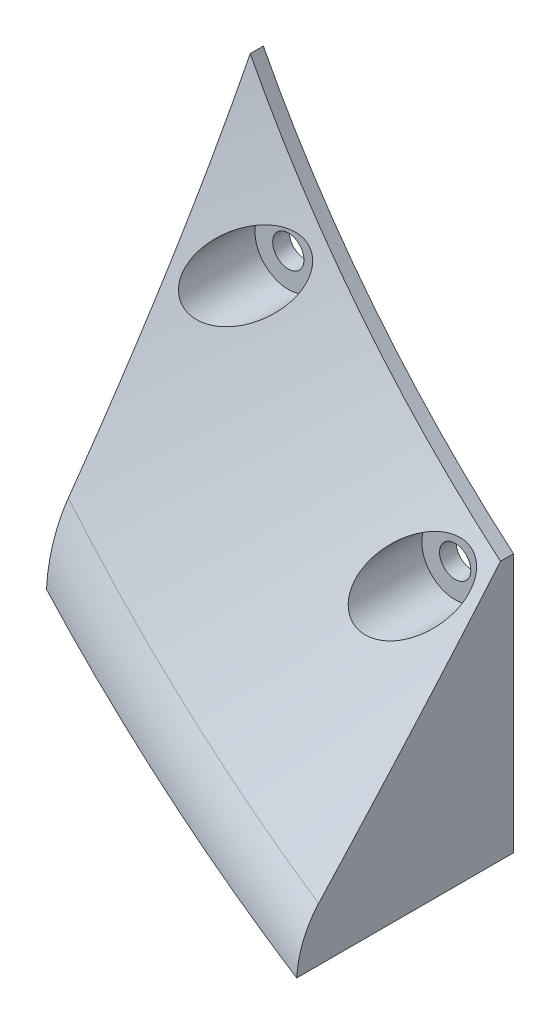
from build123d import *

# Parameters (mm, degrees)
SKETCH1_R               = 2.38125
BOSS_EXTRUDE1_DEPTH     = 3.175
BOSS_EXTRUDE2_DEPTH     = 50.8
CUT_EXTRUDE1_DEPTH      = 209.526843613
CUT_EXTRUDE1_DEPTH_BACK = 209.526843613
SKETCH3_R               = 203.829254644
SKETCH3_R_2             = 174.625
SKETCH5_R               = 2.38125
CUT_EXTRUDE3_DEPTH      = 200.484174202
SKETCH6_W               = 205.731089426
SKETCH6_H               = 25.4
BOSS_EXTRUDE3_DEPTH     = 3.175
SKETCH8_R               = 2.38125
CUT_EXTRUDE5_DEPTH      = 200.484174202
SKETCH9_W               = 205.731089426
SKETCH9_H               = 38.1
BOSS_EXTRUDE4_DEPTH     = 3.175
SKETCH10_R              = 6.35
SKETCH10_R_2            = 2.38125
CUT_EXTRUDE6_DEPTH      = 200.484174202
SKETCH11_W              = 53.331089426
SKETCH11_H              = 31.75
BOSS_EXTRUDE5_DEPTH     = 3.175
FILLET1_R               = 10.16
SKETCH12_R              = 6.35
SKETCH12_R_2            = 2.38125
CUT_EXTRUDE7_DEPTH      = 200.484174202
FILLET2_R               = 2.54
CUT_EXTRUDE8_DEPTH      = 200.484174202
SKETCH14_W              = 2.759281453
SKETCH14_H              = 7.963584416
SKETCH14_W_2            = 2.527010149
SKETCH14_H_2            = 5.938870156
BOSS_EXTRUDE6_DEPTH     = 3.175
FILLET3_R               = 2.54
SKETCH15_R              = 2.38125
BOSS_EXTRUDE7_DEPTH     = 33.02
SKETCH16_R              = 227.754671792
SKETCH16_W              = 368.539826918
SKETCH16_H              = 147.114866813
CUT_EXTRUDE9_DEPTH      = 217.033643064
SKETCH17_R              = 87.195519402
CUT_EXTRUDE10_DEPTH     = 217.033642998
CHAMFER1_SIZE           = 27.94
CHAMFER1_SIZE_2         = 31.030513664
CUT_EXTRUDE12_START     = -2.54
SKETCH18_R              = 5.08
CUT_EXTRUDE12_DEPTH     = 33.02
FILLET4_R               = 10.16


with BuildPart() as part:
    # Sketch1 → Boss-Extrude1 (new body)
    with BuildSketch(Plane.XY):
        with BuildLine():
            Line((-102.865544713, 31.75), (-102.865544713, 145.022480019))
            ThreePointArc((-102.865544713, 145.022480019), (-123.286100955, 128.114703728), (-140.965544713, 108.358457002))
            Line((-140.965544713, 108.358457002), (-140.965544713, -108.358457002))
            ThreePointArc((-140.965544713, -108.358457002), (-123.286100955, -128.114703728), (-102.865544713, -145.022480019))
            Line((-102.865544713, -145.022480019), (-102.865544713, -69.85))
            Line((-102.865544713, -69.85), (102.865544713, -69.85))
            Line((102.865544713, -69.85), (102.865544713, -145.022480019))
            ThreePointArc((102.865544713, -145.022480019), (123.286100955, -128.114703728), (140.965544713, -108.358457002))
            Line((140.965544713, -108.358457002), (140.965544713, 108.358457002))
            ThreePointArc((140.965544713, 108.358457002), (123.286100955, 128.114703728), (102.865544713, 145.022480019))
            Line((102.865544713, 145.022480019), (102.865544713, 31.75))
            Line((102.865544713, 31.75), (-102.865544713, 31.75))
        make_face()
        with Locations((25.4, -38.1)):
            Circle(SKETCH1_R, mode=Mode.SUBTRACT)
        with Locations((-25.4, -38.1)):
            Circle(SKETCH1_R, mode=Mode.SUBTRACT)
        with Locations((0, -38.1)):
            Circle(SKETCH1_R, mode=Mode.SUBTRACT)
    extrude(amount=BOSS_EXTRUDE1_DEPTH)

    # Sketch2 → Boss-Extrude2 (add)
    with BuildSketch(Plane.XY.offset(3.175)):
        with BuildLine():
            ThreePointArc((-102.865544713, -141.111907137), (-123.390730203, -123.566250752), (-140.965544713, -103.06602655))
            Line((-140.965544713, -103.06602655), (-140.965544713, -108.358457002))
            ThreePointArc((-140.965544713, -108.358457002), (-123.286100955, -128.114703728), (-102.865544713, -145.022480019))
            Line((-102.865544713, -145.022480019), (-102.865544713, -141.111907137))
        make_face()
        with BuildLine():
            ThreePointArc((140.965544713, -103.06602655), (123.390730203, -123.566250752), (102.865544713, -141.111907137))
            Line((102.865544713, -141.111907137), (102.865544713, -145.022480019))
            ThreePointArc((102.865544713, -145.022480019), (123.286100955, -128.114703728), (140.965544713, -108.358457002))
            Line((140.965544713, -108.358457002), (140.965544713, -103.06602655))
        make_face()
    extrude(amount=BOSS_EXTRUDE2_DEPTH)

    # Sketch3 → Cut-Extrude1 (cut, two sides: drawn at the far end of the back side and taken through both)
    with BuildSketch(Plane.XY.offset(3.175).offset(-CUT_EXTRUDE1_DEPTH_BACK)):
        Circle(SKETCH3_R)
        Circle(SKETCH3_R_2, mode=Mode.SUBTRACT)
    extrude(amount=CUT_EXTRUDE1_DEPTH + CUT_EXTRUDE1_DEPTH_BACK, mode=Mode.SUBTRACT)

    # Sketch5 → Cut-Extrude3 (cut, through all)
    with BuildSketch(Plane.XY.offset(3.175)):
        with Locations((134.615544713, -95.585904409)):
            Circle(SKETCH5_R)
        with Locations((109.215544713, -123.814275401)):
            Circle(SKETCH5_R)
        with Locations(Location((-134.615544713, -95.585904409, 0), (0, 0, 180))):
            Circle(SKETCH5_R)
        with Locations(Location((-109.215544713, -123.814275401, 0), (0, 0, 180))):
            Circle(SKETCH5_R)
    extrude(amount=-CUT_EXTRUDE3_DEPTH, mode=Mode.SUBTRACT)

    # Sketch6 → Boss-Extrude3 (add)
    with BuildSketch(Plane.XY.offset(3.175)):
        with Locations((0, 77.611907137)):
            Rectangle(SKETCH6_W, SKETCH6_H)
    extrude(amount=-BOSS_EXTRUDE3_DEPTH)

    # Sketch8 → Cut-Extrude5 (cut, through all)
    with BuildSketch(Plane.XY.offset(3.175)):
        with Locations((-38.1, -38.1)):
            Circle(SKETCH8_R)
        with Locations((-50.8, -38.1)):
            Circle(SKETCH8_R)
        with Locations((12.7, -38.1)):
            Circle(SKETCH8_R)
        with Locations((-12.7, -38.1)):
            Circle(SKETCH8_R)
    extrude(amount=-CUT_EXTRUDE5_DEPTH, mode=Mode.SUBTRACT)

    # Sketch9 → Boss-Extrude4 (add)
    with BuildSketch(Plane.XY.offset(3.175)):
        with Locations((0, -88.9)):
            Rectangle(SKETCH9_W, SKETCH9_H)
    extrude(amount=-BOSS_EXTRUDE4_DEPTH)

    # Sketch10 → Cut-Extrude6 (cut, through all)
    with BuildSketch(Plane.XY.offset(3.175)):
        with Locations((0, -76.2)):
            Circle(SKETCH10_R)
        with Locations((-25.4, -76.2)):
            Circle(SKETCH10_R_2)
        with Locations((-38.1, -76.2)):
            Circle(SKETCH10_R_2)
        with Locations((25.4, -76.2)):
            Circle(SKETCH10_R_2)
    extrude(amount=-CUT_EXTRUDE6_DEPTH, mode=Mode.SUBTRACT)

    # Sketch11 → Boss-Extrude5 (add)
    with BuildSketch(Plane.XY.offset(3.175)):
        with Locations((0, -123.825)):
            Rectangle(SKETCH11_W, SKETCH11_H)
    extrude(amount=-BOSS_EXTRUDE5_DEPTH)

    # Fillet1
    fillet1_edges = [part.edges().sort_by_distance(p)[0] for p in [
        (-26.665544713, -139.7, 1.5875),
        (-26.665544713, -107.95, 1.5875),
        (26.665544713, -107.95, 1.5875),
        (26.665544713, -139.7, 1.5875),
    ]]
    fillet(fillet1_edges, radius=FILLET1_R)

    # Sketch12 → Cut-Extrude7 (cut, through all)
    with BuildSketch(Plane.XY.offset(3.175)):
        with Locations((-25.4, -76.2)):
            Circle(SKETCH12_R)
        with Locations((25.4, -76.2)):
            Circle(SKETCH12_R)
        with Locations((-8.66775, -67.53225)):
            Circle(SKETCH12_R_2)
        with Locations((8.66775, -67.53225)):
            Circle(SKETCH12_R_2)
        with Locations((8.66775, -84.86775)):
            Circle(SKETCH12_R_2)
        with Locations((-8.66775, -84.86775)):
            Circle(SKETCH12_R_2)
    extrude(amount=-CUT_EXTRUDE7_DEPTH, mode=Mode.SUBTRACT)

    # Fillet2
    fillet2_edges = [part.edges().sort_by_distance(p)[0] for p in [
        (-102.865544713, 141.111907137, 1.5875),
        (102.865544713, 141.111907137, 1.5875),
    ]]
    fillet(fillet2_edges, radius=FILLET2_R)

    # Sketch13 → Cut-Extrude8 (cut, through all)
    # profile 1 of 4: a face of its own
    with BuildSketch(Plane.XY.offset(3.175)):
        with BuildLine():
            Line((-29.807958333, -15.810565048), (-38.216416667, -15.810565048))
            Line((-38.216416667, -15.810565048), (-33.538583333, 6.245101619))
            Line((-33.538583333, 6.245101619), (-38.803791667, 6.245101619))
            Line((-38.803791667, 6.245101619), (-39.682208333, 2.075268285))
            Line((-39.682208333, 2.075268285), (-48.095958333, 2.075268285))
            Line((-48.095958333, 2.075268285), (-47.397458333, 5.477809952))
            add(Edge.make_bspline(
                [(-47.397458333, 5.477809952), (-47.320569058, 5.758194134), (-47.170922216, 6.303895823), (-46.789013651, 7.053374007), (-46.29771223, 7.715065901), (-45.690436731, 8.272796577), (-45.006500067, 8.730292102), (-44.253147871, 9.054960677), (-43.448405111, 9.260244914), (-42.891974442, 9.282012228), (-42.6085, 9.293101619)],
                knots=[0, 0, 0, 0, 1.050168006, 2.043904372, 3.024673376, 4.01863537, 5.013909092, 5.989008141, 6.975497172, 8, 8, 8, 8], degree=3))
            Line((-42.6085, 9.293101619), (-24.463375, 9.293101619))
            Line((-24.463375, 9.293101619), (-29.807958333, -15.810565048))
        make_face()
    # profile 2 of 4: a face of its own
    with BuildSketch(Plane.XY.offset(3.175)):
        with BuildLine():
            add(Edge.make_bspline(
                [(-3.566583333, -12.132856715), (-3.643765668, -12.421811436), (-3.79437451, -12.985659844), (-4.17293599, -13.764550451), (-4.665381385, -14.453577746), (-5.270434906, -15.036263062), (-5.950809803, -15.518035961), (-6.703009887, -15.859816489), (-7.511777843, -16.068702787), (-8.070292693, -16.093985699), (-8.355541667, -16.106898381)],
                knots=[0, 0, 0, 0, 1.062369753, 2.073042759, 3.062499936, 4.061251344, 5.048575831, 6.014824268, 6.986115874, 8, 8, 8, 8], degree=3))
            Line((-8.355541667, -16.106898381), (-22.547791667, -16.106898381))
            add(Edge.make_bspline(
                [(-22.547791667, -16.106898381), (-22.69262218, -16.104596964), (-22.972752339, -16.100145578), (-23.378206431, -16.044702396), (-23.755568174, -15.960682303), (-24.107157142, -15.846746121), (-24.426210233, -15.691540895), (-24.716954418, -15.504453058), (-24.976786635, -15.281711317), (-25.203806964, -15.025677099), (-25.40308213, -14.746169713), (-25.554358436, -14.435544628), (-25.674211179, -14.106195373), (-25.74344938, -13.752832717), (-25.791514529, -13.37950469), (-25.77975916, -12.981941289), (-25.73922686, -12.562383844), (-25.682974686, -12.278883611), (-25.654, -12.132856715)],
                knots=[0, 0, 0, 0, 1.158779845, 2.241303809, 3.269110906, 4.251580925, 5.192683609, 6.101443689, 7.012833415, 7.922909267, 8.835720222, 9.751475912, 10.680528402, 11.633319635, 12.628295421, 13.687540584, 14.808885378, 16, 16, 16, 16], degree=3))
            Line((-25.654, -12.132856715), (-21.997458333, 5.319059952))
            add(Edge.make_bspline(
                [(-21.997458333, 5.319059952), (-21.920272116, 5.608009048), (-21.769655695, 6.171846477), (-21.391148554, 6.950815808), (-20.898502375, 7.639552216), (-20.293153244, 8.224337096), (-19.608609326, 8.702683082), (-18.855913228, 9.046275843), (-18.048644228, 9.254382857), (-17.4919553, 9.28003834), (-17.2085, 9.293101619)],
                knots=[0, 0, 0, 0, 1.062516124, 2.073328378, 3.062921881, 4.061810895, 5.05442655, 6.020808115, 6.992233544, 8, 8, 8, 8], degree=3))
            Line((-17.2085, 9.293101619), (-3.01625, 9.293101619))
            add(Edge.make_bspline(
                [(-3.01625, 9.293101619), (-2.871419505, 9.290800192), (-2.591289383, 9.286348788), (-2.185835038, 9.230905733), (-1.808474182, 9.146885197), (-1.456882118, 9.03295056), (-1.137839887, 8.877739913), (-0.847056821, 8.690671483), (-0.587369032, 8.467857656), (-0.359809395, 8.212092615), (-0.16209325, 7.930921186), (-0.002983257, 7.623293687), (0.114459046, 7.2921344), (0.187047795, 6.939473562), (0.223589985, 6.565305639), (0.223678302, 6.168188246), (0.179743785, 5.748571863), (0.123975462, 5.465081675), (0.09525, 5.319059952)],
                knots=[0, 0, 0, 0, 1.158432062, 2.24063113, 3.268129752, 4.250304904, 5.191125136, 6.099612471, 7.010728663, 7.920531375, 8.833068369, 9.75494936, 10.683723015, 11.636228288, 12.62940148, 13.688234619, 14.809242866, 16, 16, 16, 16], degree=3))
            Line((0.09525, 5.319059952), (-3.566583333, -12.132856715))
        make_face()
        Polygon((-13.403791667, 6.245101619), (-17.425458333, -13.058898381), (-12.16025, -13.058898381), (-8.138583333, 6.245101619), align=None, mode=Mode.SUBTRACT)
    # profile 3 of 4: a face of its own
    with BuildSketch(Plane.XY.offset(3.175)):
        with BuildLine():
            Line((11.557, 9.293101619), (8.556625, -5.269565048))
            Line((8.556625, -5.269565048), (13.827125, -5.269565048))
            Line((13.827125, -5.269565048), (16.8275, 9.293101619))
            Line((16.8275, 9.293101619), (25.235958333, 9.293101619))
            Line((25.235958333, 9.293101619), (19.896666667, -16.106898381))
            Line((19.896666667, -16.106898381), (11.482916667, -16.106898381))
            Line((11.482916667, -16.106898381), (13.165666667, -8.317565048))
            Line((13.165666667, -8.317565048), (3.439583333, -8.317565048))
            add(Edge.make_bspline(
                [(3.439583333, -8.317565048), (3.294736233, -8.315312365), (3.014573993, -8.310955241), (2.609344629, -8.25485176), (2.230636814, -8.173029355), (1.881290806, -8.050712181), (1.561052368, -7.897312045), (1.270346477, -7.709804396), (1.009103929, -7.48515858), (0.777806767, -7.227358437), (0.580756638, -6.941550122), (0.426179112, -6.6292081), (0.309007624, -6.297036788), (0.237889907, -5.94070984), (0.190785312, -5.563660832), (0.202000265, -5.162620664), (0.243321079, -4.739613917), (0.29915982, -4.45427987), (0.328083333, -4.306481715)],
                knots=[0, 0, 0, 0, 1.152191709, 2.228561082, 3.250524676, 4.231939746, 5.167691878, 6.071285285, 6.977493388, 7.902223819, 8.821393841, 9.731943086, 10.66895861, 11.616332835, 12.619603957, 13.686867372, 14.801836863, 16, 16, 16, 16], degree=3))
            Line((0.328083333, -4.306481715), (3.14325, 9.293101619))
            Line((3.14325, 9.293101619), (11.557, 9.293101619))
        make_face()
    # profile 4 of 4: a face of its own
    with BuildSketch(Plane.XY.offset(3.175)):
        with BuildLine():
            Line((33.374541667, -13.058898381), (47.0535, -13.058898381))
            Line((47.0535, -13.058898381), (46.392041667, -16.106898381))
            Line((46.392041667, -16.106898381), (24.304625, -16.106898381))
            Line((24.304625, -16.106898381), (25.802166667, -9.143065048))
            add(Edge.make_bspline(
                [(25.802166667, -9.143065048), (25.879273752, -8.861031474), (26.029757165, -8.310610268), (26.410334887, -7.552072135), (26.901419327, -6.879703753), (27.508831265, -6.311820899), (28.191228528, -5.842472815), (28.946271137, -5.513745702), (29.752164487, -5.300517366), (30.311046908, -5.28002739), (30.596416667, -5.269565048)],
                knots=[0, 0, 0, 0, 1.049169808, 2.047576474, 3.031944376, 4.027910562, 5.023553593, 5.994653504, 6.976054309, 8, 8, 8, 8], degree=3))
            Line((30.596416667, -5.269565048), (40.3225, -5.269565048))
            Line((40.3225, -5.269565048), (42.661416667, 6.245101619))
            Line((42.661416667, 6.245101619), (37.396208333, 6.245101619))
            Line((37.396208333, 6.245101619), (36.517791667, 2.075268285))
            Line((36.517791667, 2.075268285), (28.104041667, 2.075268285))
            Line((28.104041667, 2.075268285), (28.802541667, 5.477809952))
            add(Edge.make_bspline(
                [(28.802541667, 5.477809952), (28.879430942, 5.758194134), (29.029077784, 6.303895823), (29.410986349, 7.053374007), (29.90228777, 7.715065901), (30.509563269, 8.272796577), (31.193499933, 8.730292102), (31.946852129, 9.054960677), (32.751594889, 9.260244914), (33.308025558, 9.282012228), (33.5915, 9.293101619)],
                knots=[0, 0, 0, 0, 1.050168006, 2.043904372, 3.024673376, 4.01863537, 5.013909092, 5.989008141, 6.975497172, 8, 8, 8, 8], degree=3))
            Line((33.5915, 9.293101619), (47.78375, 9.293101619))
            add(Edge.make_bspline(
                [(47.78375, 9.293101619), (47.92859726, 9.290849086), (48.208759811, 9.286492252), (48.613987002, 9.230386738), (48.992702458, 9.148571481), (49.342021711, 9.026229282), (49.662353678, 8.87291663), (49.952725098, 8.685096123), (50.214324347, 8.462382804), (50.440285412, 8.20121114), (50.636405741, 7.915869715), (50.798510828, 7.606235104), (50.913345969, 7.272328086), (50.987754572, 6.916671215), (51.023365934, 6.538801464), (51.023963511, 6.138199286), (50.97928388, 5.715135649), (50.923924969, 5.429811378), (50.89525, 5.282018285)],
                knots=[0, 0, 0, 0, 1.152517565, 2.229191352, 3.251443972, 4.233136601, 5.169153376, 6.073002333, 6.979466726, 7.895134038, 8.814564014, 9.731738245, 10.66901877, 11.616660927, 12.618740334, 13.686213184, 14.801498005, 16, 16, 16, 16], degree=3))
            Line((50.89525, 5.282018285), (48.916166667, -4.306481715))
            add(Edge.make_bspline(
                [(48.916166667, -4.306481715), (48.838706266, -4.597052385), (48.687148602, -5.165577869), (48.311448965, -5.952788492), (47.817473721, -6.648200027), (47.212376239, -7.235653604), (46.533647997, -7.724482215), (45.778706123, -8.063324207), (44.971906745, -8.281163221), (44.41262475, -8.30526518), (44.127208333, -8.317565048)],
                knots=[0, 0, 0, 0, 1.06412456, 2.082047477, 3.072647496, 4.071792832, 5.058775816, 6.021176094, 6.990153746, 8, 8, 8, 8], degree=3))
            Line((44.127208333, -8.317565048), (34.395833333, -8.317565048))
            Line((34.395833333, -8.317565048), (33.374541667, -13.058898381))
        make_face()
    extrude(amount=-CUT_EXTRUDE8_DEPTH, mode=Mode.SUBTRACT)


with BuildPart() as cut_extrude8_piece_1:
    # of the separate pieces the step leaves, piece 1, a body of its own (cut_extrude8_pieces)
    add(part.part.solids().sort_by_distance((-106.961346111, 138.033188267, 0))[0])



with BuildPart() as cut_extrude8_piece_2:
    # of the separate pieces the step leaves, piece 2, a body of its own (cut_extrude8_pieces)
    add(part.part.solids().sort_by_distance((-8.138583333, 6.245101619, 0))[0])


with BuildPart() as cut_extrude8_piece_1_1:
    add(cut_extrude8_piece_1.part)

    add(cut_extrude8_piece_2.part)  # Boss-Extrude6 merges Cut-Extrude8 piece 2
    # Sketch14 → Boss-Extrude6 (add)
    with BuildSketch(Plane.XY.offset(3.175)):
        with Locations((-11.017521916, 7.88967512)):
            Rectangle(SKETCH14_W, SKETCH14_H)
        with Locations((-14.795211944, -14.779945163)):
            Rectangle(SKETCH14_W_2, SKETCH14_H_2)
    extrude(amount=-BOSS_EXTRUDE6_DEPTH)

    # Fillet3
    fillet3_edges = [cut_extrude8_piece_1_1.edges().sort_by_distance(p)[0] for p in [
        (102.865544713, 90.311907137, 1.5875),
        (102.865544713, 31.75, 1.5875),
        (-102.865544713, 64.911907137, 1.5875),
        (-102.865544713, 31.75, 1.5875),
        (-102.865544713, 90.311907137, 1.5875),
        (102.865544713, 64.911907137, 1.5875),
    ]]
    fillet(fillet3_edges, radius=FILLET3_R)

    # Sketch15 → Boss-Extrude7 (add)
    # profile 1 of 2: a face of its own
    with BuildSketch(Plane.XY.offset(3.175)):
        with BuildLine():
            ThreePointArc((-102.865544713, -120.914193587), (-124.246259111, -98.815128381), (-140.965544713, -73.008750871))
            Line((-140.965544713, -73.008750871), (-140.965544713, -128.136510034))
            ThreePointArc((-140.965544713, -128.136510034), (-122.97425317, -145.49083496), (-102.865544713, -160.340044003))
            Line((-102.865544713, -160.340044003), (-102.865544713, -120.914193587))
        make_face()
        with Locations((-109.215544713, -123.814275401)):
            Circle(SKETCH15_R, mode=Mode.SUBTRACT)
        with Locations((-134.615544713, -95.585904409)):
            Circle(SKETCH15_R, mode=Mode.SUBTRACT)
    # profile 2 of 2: a face of its own
    with BuildSketch(Plane.XY.offset(3.175)):
        with BuildLine():
            Line((140.965544713, -128.136510034), (140.965544713, -73.008750871))
            ThreePointArc((140.965544713, -73.008750871), (124.246259111, -98.815128381), (102.865544713, -120.914193587))
            Line((102.865544713, -120.914193587), (102.865544713, -160.340044003))
            ThreePointArc((102.865544713, -160.340044003), (122.97425317, -145.49083496), (140.965544713, -128.136510034))
        make_face()
        with Locations((109.215544713, -123.814275401)):
            Circle(SKETCH15_R, mode=Mode.SUBTRACT)
        with Locations((134.615544713, -95.585904409)):
            Circle(SKETCH15_R, mode=Mode.SUBTRACT)
    extrude(amount=BOSS_EXTRUDE7_DEPTH)

    # Sketch16 → Cut-Extrude9 (cut, through all)
    with BuildSketch(Plane.XY.offset(3.175)):
        Circle(SKETCH16_R)
        with Locations((23.411183864, 115.93750226)):
            Rectangle(SKETCH16_W, SKETCH16_H)
    extrude(amount=-CUT_EXTRUDE9_DEPTH, mode=Mode.SUBTRACT)


with BuildPart() as cut_extrude9_piece_1:
    # of the separate pieces the step leaves, piece 1, a body of its own (cut_extrude9_pieces)
    add(cut_extrude8_piece_1_1.part.solids().sort_by_distance((-140.965544713, -128.136510034, 3.175))[0])

    # Chamfer1
    # the kernel refuses this chamfer: 31.030513664, 27.94 mm, written as the material it takes off along each edge
    with BuildSketch(Plane(origin=(0, 0, 36.195), x_dir=(-0.20017923188636447, -0.9797592944807337, 0), z_dir=(0.9797592944807337, -0.20017923188636447, 0))) as chamfer1_piece_1:
        Polygon((158.75 + CHAMFER1_SIZE, 0), (158.75, CHAMFER1_SIZE_2), (158.75, 0), align=None)
    revolve(axis=Axis((0, 0, 36.195), (0, 0, -1)), revolution_arc=79.913485183, mode=Mode.SUBTRACT)

    # Sketch18 → Cut-Extrude12 (cut)
    with BuildSketch(Plane(origin=(0, 0, 3.175), x_dir=(-1, 0, 0), z_dir=(0, 0, -1)).offset(CUT_EXTRUDE12_START)):
        with Locations((134.615544713, -95.585904409)):
            Circle(SKETCH18_R)
        with Locations((109.215544713, -123.814275401)):
            Circle(SKETCH18_R)
    extrude(amount=-CUT_EXTRUDE12_DEPTH, mode=Mode.SUBTRACT)

    # Fillet4
    # the kernel refuses this fillet: 10.16 mm, written as the material it takes off along each edge
    with BuildSketch(Plane(origin=(0, 0, 36.195), x_dir=(-0.4998842027499923, -0.8660922490364434, 0), z_dir=(0.8660922490364434, -0.4998842027499923, 0))) as fillet4_piece_1:
        with BuildLine():
            CenterArc((191.237667396, 10.133185423), FILLET4_R, 222, 43.836372996)
            Line((183.68731597, 3.334818462), (183.536308941, 3.198851123))
            Line((183.536308941, 3.198851123), (186.538992971, -0.135967339))
            Line((186.538992971, -0.135967339), (186.69, -0.2032))
            ThreePointArc((186.69, -0.2032), (188.595, -0.2032), (190.485246652, -0.202663708))
            Line((190.485246652, -0.202663708), (190.5, 0))
        make_face()
    revolve(axis=Axis((0, 0, 36.195), (0, 0, -1)), revolution_arc=22.482929592, mode=Mode.SUBTRACT)


with BuildPart() as cut_extrude9_piece_2:
    # of the separate pieces the step leaves, piece 2, a body of its own (cut_extrude9_pieces)
    add(cut_extrude8_piece_1_1.part.solids().sort_by_distance((140.965544713, -73.008750871, 3.175))[0])

    # Sketch17 → Cut-Extrude10 (cut, through all)
    with BuildSketch(Plane.XY.offset(36.195)):
        with Locations((124.015012721, -121.332950523)):
            Circle(SKETCH17_R)
    extrude(amount=-CUT_EXTRUDE10_DEPTH, mode=Mode.SUBTRACT)


solid = cut_extrude9_piece_1.part
